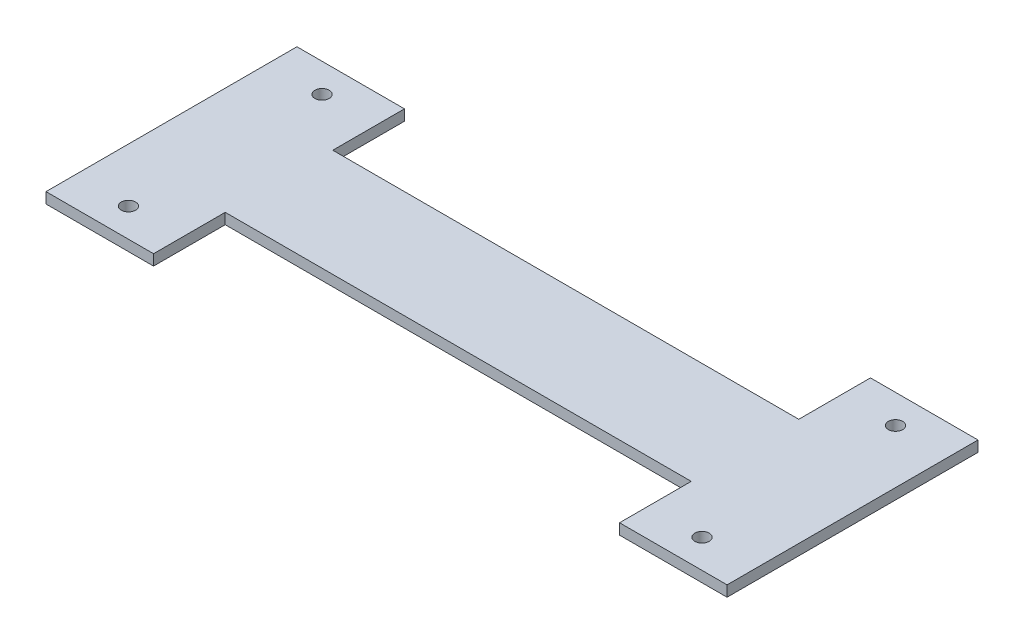
from build123d import *

# Parameters (mm, degrees)
CROQUIS1_W              = 190
CROQUIS1_H              = 70
SALIENTE_EXTRUIR1_DEPTH = 3
CROQUIS2_R              = 2
CROQUIS2_W              = 130
CROQUIS2_H              = 20
CORTAR_EXTRUIR1_DEPTH   = 3


with BuildPart() as part:
    # Croquis1 → Saliente-Extruir1 (new body)
    with BuildSketch(Plane(origin=(0, 0, 0), x_dir=(1, 0, 0), z_dir=(0, 1, 0))):
        with Locations((95, -35)):
            Rectangle(CROQUIS1_W, CROQUIS1_H)
    extrude(amount=SALIENTE_EXTRUIR1_DEPTH)

    # Croquis2 → Cortar-Extruir1 (cut)
    with BuildSketch(Plane(origin=(0, 3, 0), x_dir=(1, 0, 0), z_dir=(0, 1, 0))):
        with Locations((15, -8)):
            Circle(CROQUIS2_R)
        with Locations((175, -8)):
            Circle(CROQUIS2_R)
        with Locations((175, -62)):
            Circle(CROQUIS2_R)
        with Locations((15, -62)):
            Circle(CROQUIS2_R)
        with Locations((95, -10)):
            Rectangle(CROQUIS2_W, CROQUIS2_H)
        with Locations((95, -60)):
            Rectangle(CROQUIS2_W, CROQUIS2_H)
    extrude(amount=-CORTAR_EXTRUIR1_DEPTH, mode=Mode.SUBTRACT)


solid = part.part
